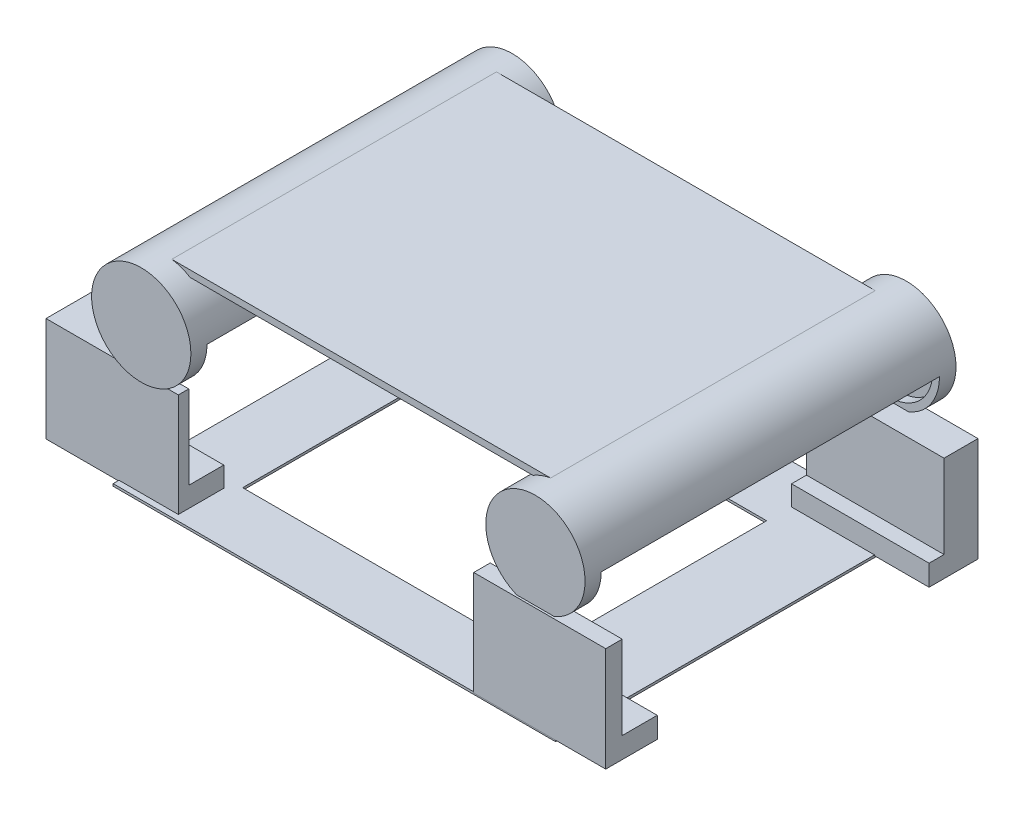
from build123d import *

# Parameters (mm, degrees)
MOTORHOLDERS_DEPTH            = 80
MOTORHOLDERS_DEPTH_BACK       = 80
MOTORHOLDERSSKETCH_R          = 21.41
MOTORHOLDERS_2_DEPTH          = 80
MOTORHOLDERS_2_DEPTH_BACK     = 80
BOSS_EXTRUDE2_DEPTH           = 70
BOSS_EXTRUDE2_DEPTH_BACK      = 70
SKETCH3_W                     = 166.402948119
SKETCH3_H                     = 2.817422897
SKETCH4_W                     = 262.774983374
SKETCH4_H                     = 145.919891702
CUT_EXTRUDE1_DEPTH            = 23
MOTORHOLDEREXTRUDE_DEPTH      = 77
MOTORHOLDEREXTRUDE_DEPTH_BACK = 77
MOTORHOLDEREXTRUDESKETCH_R    = 18.415
POWERBANKHOLDERS_DEPTH        = 30
POWERBANKHOLDERS_DEPTH_BACK   = 15
SKETCH6_W                     = 54.37662759
SKETCH6_H                     = 22.639087533
POWERBANKHOLDERS_2_DEPTH      = 30
POWERBANKHOLDERS_2_DEPTH_BACK = 15
SKETCH6_W_2                   = 57.074330216
SKETCH6_H_2                   = 19.610970688
POWERBANKHOLDERS_3_DEPTH      = 30
POWERBANKHOLDERS_3_DEPTH_BACK = 15
SKETCH6_W_3                   = 59.321562072
SKETCH6_H_3                   = 21.099390751
POWERBANKHOLDERS_4_DEPTH      = 30
POWERBANKHOLDERS_4_DEPTH_BACK = 15
SKETCH6_W_4                   = 56.923276139
SKETCH6_H_4                   = 22.224225301
SKETCH7_W                     = 190.824703485
SKETCH7_H                     = 154.667210728
SKETCH7_W_2                   = 125.335149465
SKETCH7_H_2                   = 100.638457321
TOPCELLPHONECOVER_DEPTH       = 1
CUT_EXTRUDE3_DEPTH            = 21
CUT_EXTRUDE3_DEPTH_BACK       = 21
SKETCH9_W                     = 243.146360692
SKETCH9_H                     = 137


with BuildPart() as part:
    # MotorHoldersSketch → MotorHolders (new, two sides: drawn at the far end of the back side and taken through both)
    with BuildSketch(Plane.XY.offset(-MOTORHOLDERS_DEPTH_BACK)):
        Circle(MOTORHOLDERSSKETCH_R)
    extrude(amount=MOTORHOLDERS_DEPTH + MOTORHOLDERS_DEPTH_BACK)


with BuildPart() as body_2:
    # MotorHoldersSketch → MotorHolders 2 (new, two sides: drawn at the far end of the back side and taken through both)
    with BuildSketch(Plane.XY.offset(-MOTORHOLDERS_2_DEPTH_BACK)):
        with Locations((170, 0)):
            Circle(MOTORHOLDERSSKETCH_R)
    extrude(amount=MOTORHOLDERS_2_DEPTH + MOTORHOLDERS_2_DEPTH_BACK)

    # Sketch3 → Boss-Extrude2 (add, two sides: drawn at the far end of the back side and taken through both)
    with BuildSketch(Plane.XY.offset(-BOSS_EXTRUDE2_DEPTH_BACK)):
        with Locations((85.14207121, 19.724241304)):
            Rectangle(SKETCH3_W, SKETCH3_H)
    extrude(amount=BOSS_EXTRUDE2_DEPTH + BOSS_EXTRUDE2_DEPTH_BACK)


with BuildPart() as cut_extrude1_tool:
    # Sketch4 → Cut-Extrude1 (new body)
    with BuildSketch(Plane(origin=(0, 0, 0), x_dir=(1, 0, 0), z_dir=(0, 1, 0))):
        with Locations((89.893628689, -0.090874356)):
            Rectangle(SKETCH4_W, SKETCH4_H)
    extrude(amount=-CUT_EXTRUDE1_DEPTH)


with BuildPart() as part_1:
    add(part.part)

    # Cut-Extrude1: cut by cut_extrude1_tool
    add(cut_extrude1_tool.part, mode=Mode.SUBTRACT)


with BuildPart() as body_2_1:
    add(body_2.part)

    # Cut-Extrude1: cut by cut_extrude1_tool
    add(cut_extrude1_tool.part, mode=Mode.SUBTRACT)


with BuildPart() as motorholderextrude_tool:
    # MotorHolderExtrudeSketch → MotorHolderExtrude (new, two sides: drawn at the far end of the back side and taken through both)
    with BuildSketch(Plane.XY.offset(-MOTORHOLDEREXTRUDE_DEPTH_BACK)):
        with Locations((170, 0)):
            Circle(MOTORHOLDEREXTRUDESKETCH_R)
        Circle(MOTORHOLDEREXTRUDESKETCH_R)
    extrude(amount=MOTORHOLDEREXTRUDE_DEPTH + MOTORHOLDEREXTRUDE_DEPTH_BACK)


with BuildPart() as part_2:
    add(part_1.part)

    # MotorHolderExtrude: cut by motorholderextrude_tool
    add(motorholderextrude_tool.part, mode=Mode.SUBTRACT)


with BuildPart() as body_2_2:
    add(body_2_1.part)

    # MotorHolderExtrude: cut by motorholderextrude_tool
    add(motorholderextrude_tool.part, mode=Mode.SUBTRACT)


with BuildPart() as body_3:
    # Sketch6 → PowerBankHolders (new, two sides: drawn at the far end of the back side and taken through both)
    with BuildSketch(Plane(origin=(170, -34.829272125, 0), x_dir=(-1, 0, 0), z_dir=(0, -1, 0)).offset(-POWERBANKHOLDERS_DEPTH_BACK)):
        with Locations((181.760041453, 67.629448186)):
            Rectangle(SKETCH6_W, SKETCH6_H)
    extrude(amount=POWERBANKHOLDERS_DEPTH + POWERBANKHOLDERS_DEPTH_BACK)



with BuildPart() as body_4:
    # Sketch6 → PowerBankHolders 2 (new, two sides: drawn at the far end of the back side and taken through both)
    with BuildSketch(Plane(origin=(170, -34.829272125, 0), x_dir=(-1, 0, 0), z_dir=(0, -1, 0)).offset(-POWERBANKHOLDERS_2_DEPTH_BACK)):
        with Locations((184.263893871, -68.476666678)):
            Rectangle(SKETCH6_W_2, SKETCH6_H_2)
    extrude(amount=POWERBANKHOLDERS_2_DEPTH + POWERBANKHOLDERS_2_DEPTH_BACK)


with BuildPart() as body_5:
    # Sketch6 → PowerBankHolders 3 (new, two sides: drawn at the far end of the back side and taken through both)
    with BuildSketch(Plane(origin=(170, -34.829272125, 0), x_dir=(-1, 0, 0), z_dir=(0, -1, 0)).offset(-POWERBANKHOLDERS_3_DEPTH_BACK)):
        with Locations((-3.363277236, 67.312978676)):
            Rectangle(SKETCH6_W_3, SKETCH6_H_3)
    extrude(amount=POWERBANKHOLDERS_3_DEPTH + POWERBANKHOLDERS_3_DEPTH_BACK)


with BuildPart() as body_6:
    # Sketch6 → PowerBankHolders 4 (new, two sides: drawn at the far end of the back side and taken through both)
    with BuildSketch(Plane(origin=(170, -34.829272125, 0), x_dir=(-1, 0, 0), z_dir=(0, -1, 0)).offset(-POWERBANKHOLDERS_4_DEPTH_BACK)):
        with Locations((-2.760596187, -69.783293985)):
            Rectangle(SKETCH6_W_4, SKETCH6_H_4)
    extrude(amount=POWERBANKHOLDERS_4_DEPTH + POWERBANKHOLDERS_4_DEPTH_BACK)


with BuildPart() as body_3_1:
    add(body_3.part)

    add(body_4.part)  # TopCellPhoneCover merges body 4

    add(body_5.part)  # TopCellPhoneCover merges body 5

    add(body_6.part)  # TopCellPhoneCover merges body 6
    # Sketch7 → TopCellPhoneCover (add)
    with BuildSketch(Plane(origin=(170, -64.5, 0), x_dir=(-1, 0, 0), z_dir=(0, -1, 0))):
        with Locations((85.907620295, -3.467393964)):
            Rectangle(SKETCH7_W, SKETCH7_H)
        with Locations((89.203645692, -4.077931617)):
            Rectangle(SKETCH7_W_2, SKETCH7_H_2, mode=Mode.SUBTRACT)
    extrude(amount=TOPCELLPHONECOVER_DEPTH)

    # Sketch9 → Cut-Extrude3 (cut, two sides: drawn at the far end of the back side and taken through both)
    with BuildSketch(Plane(origin=(170, -34.829272125, 0), x_dir=(-1, 0, 0), z_dir=(0, -1, 0)).offset(-CUT_EXTRUDE3_DEPTH_BACK)):
        with Locations((61.591374201, -5.281433869)):
            Rectangle(SKETCH9_W, SKETCH9_H)
    extrude(amount=CUT_EXTRUDE3_DEPTH + CUT_EXTRUDE3_DEPTH_BACK, mode=Mode.SUBTRACT)


solid = Compound([part_2.part, body_2_2.part, body_3_1.part])
